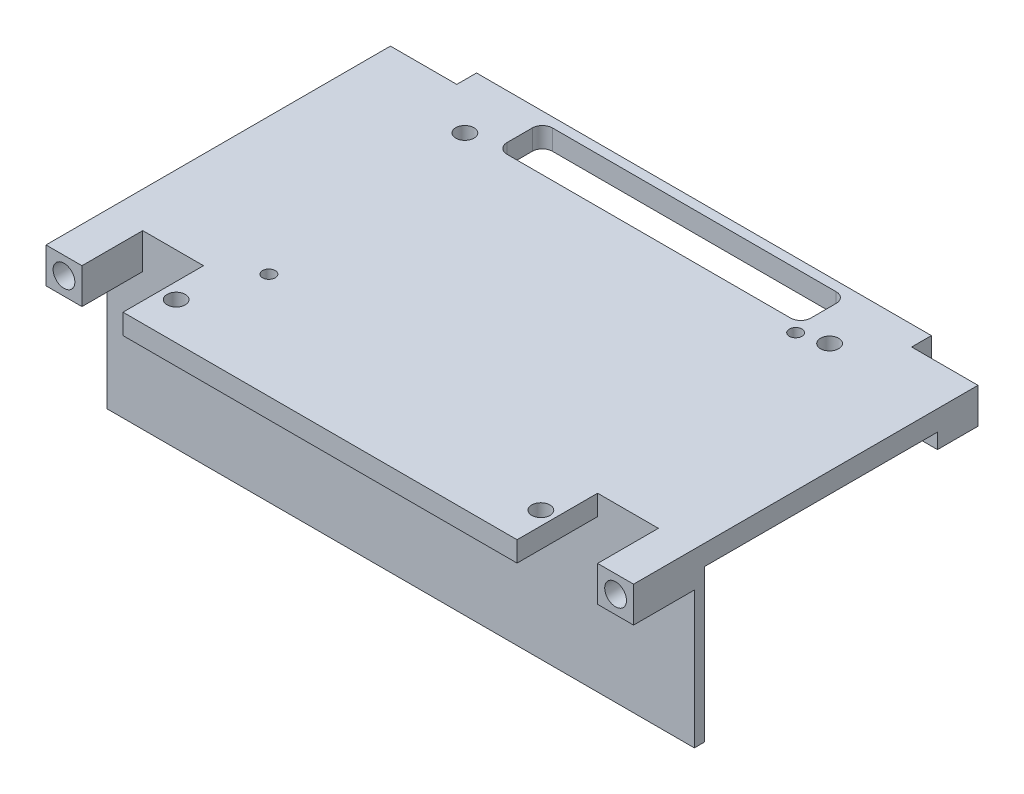
from build123d import *

# Parameters (mm, degrees)
BOSS_EXTRUDE1_DEPTH             = 4
SKETCH3_W                       = 7.1
SKETCH3_H                       = 8
BOSS_EXTRUDE3_DEPTH             = 3
SKETCH4_R                       = 2.15
CUT_EXTRUDE1_DEPTH              = 7
MIRROR2_COPY_1_SKETCH_W         = 7.1
MIRROR2_COPY_1_SKETCH_H         = 8
MIRROR2_COPY_1_DEPTH            = 3
MIRROR2_COPY_2_SKETCH_R         = 2.15
MIRROR2_COPY_2_DEPTH            = 7
SKETCH5_W                       = 60
SKETCH5_H                       = 9
CUT_EXTRUDE2_DEPTH              = 72.37226352
FILLET1_R                       = 2
SKETCH7_W                       = 101.8
SKETCH7_H                       = 1
CUT_EXTRUDE3_DEPTH              = 72.37226352
SKETCH8_W                       = 116
SKETCH8_H                       = 2
BOSS_EXTRUDE4_DEPTH             = 30
SKETCH9_W                       = 12
SKETCH9_H                       = 18
CUT_EXTRUDE4_DEPTH              = 10
SKETCH10_W                      = 7.1
SKETCH10_H                      = 4
BOSS_EXTRUDE5_DEPTH             = 3
SKETCH12_W                      = 1.5
SKETCH12_H                      = 4
BOSS_EXTRUDE6_DEPTH             = 2
SKETCH13_W                      = 36
SKETCH13_H                      = 2
BOSS_EXTRUDE7_DEPTH             = 30
SKETCH14_W                      = 1.5
SKETCH14_H                      = 4
BOSS_EXTRUDE8_DEPTH             = 1
BOSS_EXTRUDE9_REACH             = 79.055
BOSS_EXTRUDE9_DIRECTION_2_REACH = 79.055
SKETCH16_W                      = 20
SKETCH16_H                      = 28
SKETCH16_W_2                    = 14.6
SKETCH16_H_2                    = 9.2
BOSS_EXTRUDE10_DEPTH            = 2.6
SKETCH17_W                      = 12
SKETCH17_H                      = 18
CUT_EXTRUDE5_DEPTH              = 78.054785705
SKETCH18_W                      = 6
SKETCH18_H                      = 6
CUT_EXTRUDE6_DEPTH              = 79.759380394
SKETCH22_R                      = 1.25
CUT_EXTRUDE7_DEPTH              = 4
SKETCH25_W                      = 6
SKETCH25_H                      = 30
CUT_EXTRUDE11_DEPTH             = 10
CUT_EXTRUDE12_DEPTH             = 78.810282097
CUT_EXTRUDE12_DEPTH_BACK        = 78.810282097
SKETCH26_W                      = 6.843369225
SKETCH26_H                      = 31.263319976
SKETCH26_W_2                    = 6.53419365
SKETCH26_H_2                    = 28.524331859
SKETCH27_R                      = 1.25
CUT_EXTRUDE13_DEPTH             = 79.230428862
SKETCH28_W                      = 89.8
SKETCH28_H                      = 0.6
SKETCH28_W_2                    = 77.8
CUT_EXTRUDE14_DEPTH             = 79.230428862
CHAMFER1_SIZE                   = 2
SKETCH29_W                      = 20
SKETCH29_H                      = 28
CUT_EXTRUDE15_DEPTH             = 17.4
CUT_EXTRUDE16_DEPTH             = 2
SKETCH30_W                      = 89.8
SKETCH30_H                      = 1.5
SKETCH30_W_2                    = 77.8
CUT_EXTRUDE17_DEPTH             = 78.925348892
SKETCH32_W                      = 6
SKETCH32_H                      = 14
BOSS_EXTRUDE11_DEPTH            = 1
CHAMFER2_SIZE                   = 1
SKETCH34_W                      = 6
SKETCH34_H                      = 14
BOSS_EXTRUDE12_DEPTH            = 3
CHAMFER3_SIZE                   = 3
SKETCH33_R                      = 1.65
CUT_EXTRUDE18_DEPTH             = 6
CHAMFER4_SIZE                   = 3
SKETCH35_R                      = 1.8
CUT_EXTRUDE19_DEPTH             = 78.177781777


with BuildPart() as part:
    # Sketch1 → Boss-Extrude1 (new body)
    with BuildSketch(Plane(origin=(0, 0, 0), x_dir=(1, 0, 0), z_dir=(0, 1, 0))):
        Polygon((-58, -34), (-50.9, -34), (-50.9, -41), (50.9, -41), (50.9, -34), (58, -34), (58, 34), (50.9, 34), (50.9, 41), (-50.9, 41), (-50.9, 34), (-58, 34), align=None)
    extrude(amount=BOSS_EXTRUDE1_DEPTH)

    # Sketch3 → Boss-Extrude3 (add)
    with BuildSketch(Plane.XZ):
        with Locations((-54.45, -30)):
            Rectangle(SKETCH3_W, SKETCH3_H)
    boss_extrude3 = extrude(amount=BOSS_EXTRUDE3_DEPTH)

    # Sketch4 → Cut-Extrude1 (cut)
    with BuildSketch(Plane(origin=(0, 0, -34), x_dir=(-1, 0, 0), z_dir=(0, 0, -1))):
        with Locations((54.45, 0.5)):
            Circle(SKETCH4_R)
    cut_extrude1 = extrude(amount=-CUT_EXTRUDE1_DEPTH, mode=Mode.SUBTRACT)

    # Mirror1: Boss-Extrude3, Cut-Extrude1 across plane
    add(boss_extrude3.mirror(Plane(origin=(0, 0, 0), x_dir=(0, 0, 1), z_dir=(1, 0, 0))))
    add(cut_extrude1.mirror(Plane(origin=(0, 0, 0), x_dir=(0, 0, 1), z_dir=(1, 0, 0))), mode=Mode.SUBTRACT)

    # Mirror2: Boss-Extrude3, Cut-Extrude1 across plane
    add(boss_extrude3.mirror(Plane.XY))
    add(cut_extrude1.mirror(Plane.XY), mode=Mode.SUBTRACT)

    # Mirror2 copy 1 sketch → Mirror2 copy 1 (add)
    with BuildSketch(Plane(origin=(0, 0, 0), x_dir=(-1, 0, 0), z_dir=(0, -1, 0))):
        with Locations((-54.45, -30)):
            Rectangle(MIRROR2_COPY_1_SKETCH_W, MIRROR2_COPY_1_SKETCH_H)
    extrude(amount=MIRROR2_COPY_1_DEPTH)

    # Mirror2 copy 2 sketch → Mirror2 copy 2 (cut)
    with BuildSketch(Plane.XY.offset(34)):
        with Locations((54.45, 0.5)):
            Circle(MIRROR2_COPY_2_SKETCH_R)
    extrude(amount=-MIRROR2_COPY_2_DEPTH, mode=Mode.SUBTRACT)

    # Sketch5 → Cut-Extrude2 (cut, through all)
    with BuildSketch(Plane(origin=(0, 4, 0), x_dir=(1, 0, 0), z_dir=(0, 1, 0))):
        with Locations((0, 31.5)):
            Rectangle(SKETCH5_W, SKETCH5_H)
    extrude(amount=-CUT_EXTRUDE2_DEPTH, mode=Mode.SUBTRACT)

    # Fillet1
    fillet1_edges = [part.edges().sort_by_distance(p)[0] for p in [
        (-30, 2, -27),
        (-30, 2, -36),
        (30, 2, -36),
        (30, 2, -27),
    ]]
    fillet(fillet1_edges, radius=FILLET1_R)

    # Sketch7 → Cut-Extrude3 (cut, through all)
    with BuildSketch(Plane(origin=(0, 4, 0), x_dir=(1, 0, 0), z_dir=(0, 1, 0))):
        with Locations((0, 40.5)):
            Rectangle(SKETCH7_W, SKETCH7_H)
        with Locations((0, -40.5)):
            Rectangle(SKETCH7_W, SKETCH7_H)
    extrude(amount=-CUT_EXTRUDE3_DEPTH, mode=Mode.SUBTRACT)

    # Sketch8 → Boss-Extrude4 (add)
    with BuildSketch(Plane.XZ):
        with Locations((0, 21)):
            Rectangle(SKETCH8_W, SKETCH8_H)
    extrude(amount=BOSS_EXTRUDE4_DEPTH)

    # Sketch9 → Cut-Extrude4 (cut)
    with BuildSketch(Plane(origin=(0, 4, 0), x_dir=(1, 0, 0), z_dir=(0, 1, 0))):
        with Locations((-44.9, -31)):
            Rectangle(SKETCH9_W, SKETCH9_H)
    extrude(amount=-CUT_EXTRUDE4_DEPTH, mode=Mode.SUBTRACT)

    # Sketch10 → Boss-Extrude5 (add)
    with BuildSketch(Plane.XZ.offset(3)):
        with Locations((-54.45, 24)):
            Rectangle(SKETCH10_W, SKETCH10_H)
        with Locations((54.45, 24)):
            Rectangle(SKETCH10_W, SKETCH10_H)
    extrude(amount=-BOSS_EXTRUDE5_DEPTH)

    # Sketch12 → Boss-Extrude6 (add)
    # profile 1 of 2: a face of its own
    with BuildSketch(Plane.ZY.offset(51)):
        Polygon((22, -5.8), (22, -16.2), (24.7, -13.5), (24.7, -8.5), align=None)
        with Locations((23.35, -11)):
            Rectangle(SKETCH12_W, SKETCH12_H, mode=Mode.SUBTRACT)
    # profile 2 of 2: a face of its own
    with BuildSketch(Plane.ZY.offset(51)):
        Polygon((22, -20.8), (22, -31.2), (24.7, -28.5), (24.7, -23.5), align=None)
        with Locations((23.35, -26)):
            Rectangle(SKETCH12_W, SKETCH12_H, mode=Mode.SUBTRACT)
    boss_extrude6 = extrude(amount=-BOSS_EXTRUDE6_DEPTH)

    # Mirror3: Boss-Extrude6 across plane
    add(boss_extrude6.mirror(Plane(origin=(-44.9, 0, 0), x_dir=(0, 0, 1), z_dir=(1, 0, 0))))

    # Sketch13 → Boss-Extrude7 (add)
    with BuildSketch(Plane.XZ):
        with Locations((0, -18.5)):
            Rectangle(SKETCH13_W, SKETCH13_H)
    extrude(amount=BOSS_EXTRUDE7_DEPTH)

    # Boss-Extrude9: up to this face of the body (flat: up to its plane)
    boss_extrude9_end = Plane(part.part.faces().sort_by_distance((-18, -15, -18.5))[0])
    # Sketch15 → Boss-Extrude9 (add, up to the picked face)
    with BuildSketch(Plane(origin=(0, 0, 0), x_dir=(0, 0, -1), z_dir=(1, 0, 0)), mode=Mode.PRIVATE) as boss_extrude9_sk1:
        Polygon((17.5, 0), (17.5, -5), (14.613248654, 0), align=None)
    boss_extrude9_tool1 = split(extrude(boss_extrude9_sk1.sketch, amount=-BOSS_EXTRUDE9_REACH, mode=Mode.PRIVATE), bisect_by=boss_extrude9_end, keep=Keep.BOTH, mode=Mode.PRIVATE)
    add(boss_extrude9_tool1.solids().sort_by(Axis((0, -1.666667, -16.53775), (-1, 0, 0)))[0])

    # Boss-Extrude9 direction 2: up to this face of the body (flat: up to its plane)
    boss_extrude9_direction_2_end = Plane(part.part.faces().sort_by_distance((18, -15, -18.5))[0])
    # Sketch15 → Boss-Extrude9 direction 2 (add, up to the picked face)
    with BuildSketch(Plane(origin=(0, 0, 0), x_dir=(0, 0, -1), z_dir=(1, 0, 0)), mode=Mode.PRIVATE) as boss_extrude9_direction_2_sk1:
        Polygon((17.5, 0), (17.5, -5), (14.613248654, 0), align=None)
    boss_extrude9_direction_2_tool1 = split(extrude(boss_extrude9_direction_2_sk1.sketch, amount=BOSS_EXTRUDE9_DIRECTION_2_REACH, mode=Mode.PRIVATE), bisect_by=boss_extrude9_direction_2_end, keep=Keep.BOTH, mode=Mode.PRIVATE)
    add(boss_extrude9_direction_2_tool1.solids().sort_by(Axis((0, -1.666667, -16.53775), (1, 0, 0)))[0])

    # Sketch16 → Boss-Extrude10 (add)
    with BuildSketch(Plane.XY.offset(40)):
        with Locations((28, -14)):
            Rectangle(SKETCH16_W, SKETCH16_H)
        with Locations((28, -20.4)):
            Rectangle(SKETCH16_W_2, SKETCH16_H_2, mode=Mode.SUBTRACT)
    extrude(amount=-BOSS_EXTRUDE10_DEPTH)

    # Sketch17 → Cut-Extrude5 (cut, through all)
    with BuildSketch(Plane.XZ):
        with Locations((44.9, 31)):
            Rectangle(SKETCH17_W, SKETCH17_H)
    extrude(amount=-CUT_EXTRUDE5_DEPTH, mode=Mode.SUBTRACT)

    # Sketch18 → Cut-Extrude6 (cut, through all)
    with BuildSketch(Plane(origin=(0, 4, 0), x_dir=(1, 0, 0), z_dir=(0, 1, 0))):
        with Locations((47.9, 37)):
            Rectangle(SKETCH18_W, SKETCH18_H)
        with Locations((-47.9, 37)):
            Rectangle(SKETCH18_W, SKETCH18_H)
    extrude(amount=-CUT_EXTRUDE6_DEPTH, mode=Mode.SUBTRACT)

    # Sketch22 → Cut-Extrude7 (cut)
    with BuildSketch(Plane(origin=(0, 4, 0), x_dir=(1, 0, 0), z_dir=(0, 1, 0))):
        with Locations(Location((31, 25, 0), (0, 0, 270))):
            Circle(SKETCH22_R)
        with Locations(Location((-31, -17, 0), (0, 0, 270))):
            Circle(SKETCH22_R)
    extrude(amount=-CUT_EXTRUDE7_DEPTH, mode=Mode.SUBTRACT)

    # Sketch25 → Cut-Extrude11 (cut)
    with BuildSketch(Plane(origin=(0, 0, -19.5), x_dir=(-1, 0, 0), z_dir=(0, 0, -1))):
        with Locations((-15, -15)):
            Rectangle(SKETCH25_W, SKETCH25_H)
        with Locations((15, -15)):
            Rectangle(SKETCH25_W, SKETCH25_H)
    extrude(amount=-CUT_EXTRUDE11_DEPTH, mode=Mode.SUBTRACT)

    # Sketch26 → Cut-Extrude12 (cut, two sides: drawn at the far end of the back side and taken through both)
    with BuildSketch(Plane.ZY.offset(1).offset(-CUT_EXTRUDE12_DEPTH_BACK)):
        with Locations((-23.779868126, -20.73082856)):
            Rectangle(SKETCH26_W, SKETCH26_H)
        with Locations((25.267096825, -20.06216593)):
            Rectangle(SKETCH26_W_2, SKETCH26_H_2)
    extrude(amount=CUT_EXTRUDE12_DEPTH + CUT_EXTRUDE12_DEPTH_BACK, mode=Mode.SUBTRACT)

    # Sketch27 → Cut-Extrude13 (cut, through all)
    with BuildSketch(Plane(origin=(0, 4, 0), x_dir=(1, 0, 0), z_dir=(0, 1, 0))):
        with Locations(Location((-35.8, 26.5, 0), (0, 0, 270))):
            Circle(SKETCH27_R)
        with Locations(Location((-35.8, -30.5, 0), (0, 0, 270))):
            Circle(SKETCH27_R)
        with Locations(Location((36.2, -30.5, 0), (0, 0, 270))):
            Circle(SKETCH27_R)
        with Locations(Location((36.2, 26.5, 0), (0, 0, 270))):
            Circle(SKETCH27_R)
    extrude(amount=-CUT_EXTRUDE13_DEPTH, mode=Mode.SUBTRACT)

    # Sketch28 → Cut-Extrude14 (cut, through all)
    with BuildSketch(Plane(origin=(0, 4, 0), x_dir=(1, 0, 0), z_dir=(0, 1, 0))):
        with Locations((0, 39.7)):
            Rectangle(SKETCH28_W, SKETCH28_H)
        with Locations((0, -39.7)):
            Rectangle(SKETCH28_W_2, SKETCH28_H)
    extrude(amount=-CUT_EXTRUDE14_DEPTH, mode=Mode.SUBTRACT)

    # Chamfer1
    chamfer1_edges = [part.edges().sort_by_distance(p)[0] for p in [
        (28, 0, 37.4),
    ]]
    chamfer(chamfer1_edges, length=CHAMFER1_SIZE)

    # Sketch29 → Cut-Extrude15 (cut)
    with BuildSketch(Plane.XY.offset(39.4)):
        with Locations((28, -14)):
            Rectangle(SKETCH29_W, SKETCH29_H)
    extrude(amount=-CUT_EXTRUDE15_DEPTH, mode=Mode.SUBTRACT)

    # Sketch30 → Cut-Extrude17 (cut, through all)
    with BuildSketch(Plane(origin=(0, 4, 0), x_dir=(1, 0, 0), z_dir=(0, 1, 0))):
        with Locations((0, 38.65)):
            Rectangle(SKETCH30_W, SKETCH30_H)
        with Locations((0, -38.65)):
            Rectangle(SKETCH30_W_2, SKETCH30_H)
    extrude(amount=-CUT_EXTRUDE17_DEPTH, mode=Mode.SUBTRACT)

    # Sketch32 → Boss-Extrude11 (add)
    with BuildSketch(Plane(origin=(0, 0, -19.5), x_dir=(-1, 0, 0), z_dir=(0, 0, -1))):
        with Locations((0, -21)):
            Rectangle(SKETCH32_W, SKETCH32_H)
    extrude(amount=BOSS_EXTRUDE11_DEPTH)

    # Chamfer2
    chamfer2_edges = [part.edges().sort_by_distance(p)[0] for p in [
        (0, -14, -19.5),
    ]]
    chamfer(chamfer2_edges, length=CHAMFER2_SIZE - 0.0001)  # a hair under: the kernel refuses the full size

    # Sketch34 → Boss-Extrude12 (add)
    with BuildSketch(Plane.XY.offset(-17.5)):
        with Locations((0, -21)):
            Rectangle(SKETCH34_W, SKETCH34_H)
    extrude(amount=BOSS_EXTRUDE12_DEPTH)

    # Chamfer3
    chamfer3_edges = [part.edges().sort_by_distance(p)[0] for p in [
        (0, -14, -17.5),
    ]]
    chamfer(chamfer3_edges, length=CHAMFER3_SIZE - 0.0001)  # a hair under: the kernel refuses the full size

    # Sketch33 → Cut-Extrude18 (cut)
    with BuildSketch(Plane(origin=(0, 0, -20.5), x_dir=(-1, 0, 0), z_dir=(0, 0, -1))):
        with Locations((0, -17)):
            Circle(SKETCH33_R)
        with Locations((0, -25)):
            Circle(SKETCH33_R)
    extrude(amount=-CUT_EXTRUDE18_DEPTH, mode=Mode.SUBTRACT)

    # Chamfer4
    chamfer4_edges = [part.edges().sort_by_distance(p)[0] for p in [
        (0, 0, -19.5),
    ]]
    chamfer(chamfer4_edges, length=CHAMFER4_SIZE)

    # Sketch35 → Cut-Extrude19 (cut, through all)
    with BuildSketch(Plane(origin=(0, 4, 0), x_dir=(1, 0, 0), z_dir=(0, 1, 0))):
        with Locations(Location((-35.8, 26.5, 0), (0, 0, 270))):
            Circle(SKETCH35_R)
        with Locations(Location((36.2, 26.5, 0), (0, 0, 270))):
            Circle(SKETCH35_R)
        with Locations(Location((36.2, -30.5, 0), (0, 0, 270))):
            Circle(SKETCH35_R)
        with Locations(Location((-35.8, -30.5, 0), (0, 0, 270))):
            Circle(SKETCH35_R)
    extrude(amount=-CUT_EXTRUDE19_DEPTH, mode=Mode.SUBTRACT)


with BuildPart() as body_2:
    # Sketch14 → Boss-Extrude8 (new, symmetric)
    with BuildSketch(Plane(origin=(0, 0, 0), x_dir=(0, 0, -1), z_dir=(1, 0, 0))):
        Polygon((24.2, -8.5), (21.5, -5.8), (21.5, -16.2), (24.2, -13.5), align=None)
        with Locations((22.85, -11)):
            Rectangle(SKETCH14_W, SKETCH14_H, mode=Mode.SUBTRACT)
    extrude(amount=BOSS_EXTRUDE8_DEPTH, both=True)

    # Sketch31 → Cut-Extrude16 (cut)
    with BuildSketch(Plane.ZY.offset(1)):
        Polygon((-24.2, -8.5), (-24.2, -13.5), (-21.5, -16.2), (-21.5, -5.8), align=None)
    extrude(amount=-CUT_EXTRUDE16_DEPTH, mode=Mode.SUBTRACT)


solid = part.part
